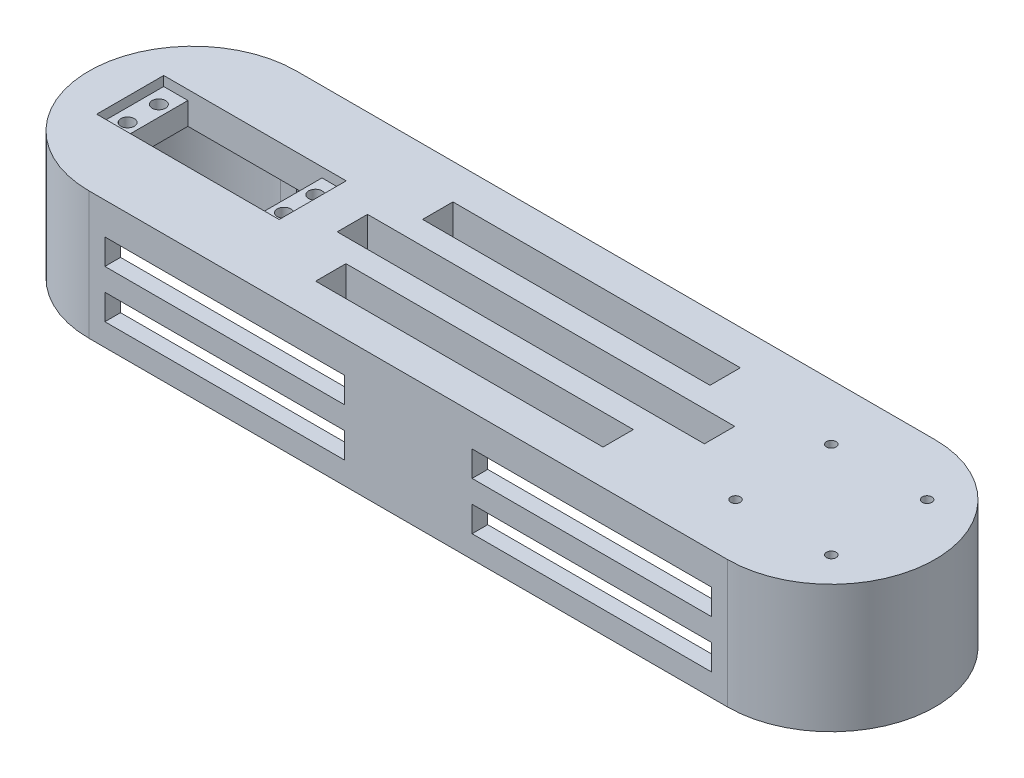
from build123d import *

# Parameters (mm, degrees)
SKETCH1_R           = 2.1
SKETCH1_R_2         = 1.5
SKETCH1_W           = 42
SKETCH1_H           = 21
BOSS_EXTRUDE1_DEPTH = 10
BOSS_EXTRUDE2_START = -30
BOSS_EXTRUDE2_DEPTH = 30
SKETCH3_W           = 75
SKETCH3_H           = 8
CUT_EXTRUDE1_DEPTH  = 45
SKETCH4_W           = 7.58
SKETCH4_H           = 21
CUT_EXTRUDE2_DEPTH  = 3


with BuildPart() as part:
    # Sketch1 → Boss-Extrude1 (new body)
    with BuildSketch(Plane(origin=(0, 0, 0), x_dir=(1, 0, 0), z_dir=(0, 1, 0))):
        with BuildLine():
            Line((-100, 32.5), (100, 32.5))
            ThreePointArc((100, 32.5), (132.5, 0), (100, -32.5))
            Line((100, -32.5), (-100, -32.5))
            ThreePointArc((-100, -32.5), (-132.5, 0), (-100, 32.5))
        make_face()
        with Locations((-115.5, 4.9)):
            Circle(SKETCH1_R, mode=Mode.SUBTRACT)
        with Locations((-115.5, -4.9)):
            Circle(SKETCH1_R, mode=Mode.SUBTRACT)
        with Locations((-66.5, -4.9)):
            Circle(SKETCH1_R, mode=Mode.SUBTRACT)
        with Locations((-66.5, 4.9)):
            Circle(SKETCH1_R, mode=Mode.SUBTRACT)
        with Locations((85, 15)):
            Circle(SKETCH1_R_2, mode=Mode.SUBTRACT)
        with Locations((115, 15)):
            Circle(SKETCH1_R_2, mode=Mode.SUBTRACT)
        with Locations((85, -15)):
            Circle(SKETCH1_R_2, mode=Mode.SUBTRACT)
        with Locations((115, -15)):
            Circle(SKETCH1_R_2, mode=Mode.SUBTRACT)
        with Locations((-91, 0)):
            Rectangle(SKETCH1_W, SKETCH1_H, mode=Mode.SUBTRACT)
        Polygon((0, 21.5), (-40, 21.5), (-40, 12), (0, 12), (50, 12), (50, 21.5), align=None, mode=Mode.SUBTRACT)
        Polygon((-50, 4.75), (0, 4.75), (65, 4.75), (65, -4.75), (0, -4.75), (-50, -4.75), align=None, mode=Mode.SUBTRACT)
        Polygon((0, -12), (-40, -12), (-40, -21.5), (0, -21.5), (50, -21.5), (50, -12), align=None, mode=Mode.SUBTRACT)
    extrude(amount=BOSS_EXTRUDE1_DEPTH)

    # Sketch2 → Boss-Extrude2 (add)
    with BuildSketch(Plane(origin=(0, 0, 0), x_dir=(1, 0, 0), z_dir=(0, 1, 0)).offset(BOSS_EXTRUDE2_START)):
        with BuildLine():
            Line((-100, 32.5), (100, 32.5))
            ThreePointArc((100, 32.5), (132.5, 0), (100, -32.5))
            Line((100, -32.5), (-100, -32.5))
            ThreePointArc((-100, -32.5), (-132.5, 0), (-100, 32.5))
        make_face()
        with BuildLine():
            Line((99.668543355, 27.510998447), (-100, 27.510998447))
            ThreePointArc((-100, 27.510998447), (-127.55585262, -0.044854173), (-100, -27.600706793))
            Line((-100, -27.600706793), (100.998461852, -27.600706793))
            ThreePointArc((100.998461852, -27.600706793), (128.562336478, 0.636345006), (99.668543355, 27.510998447))
        make_face(mode=Mode.SUBTRACT)
    extrude(amount=BOSS_EXTRUDE2_DEPTH)

    # Sketch3 → Cut-Extrude1 (cut, symmetric)
    with BuildSketch(Plane.XY):
        with Locations((-57.5, -19)):
            Rectangle(SKETCH3_W, SKETCH3_H)
        with Locations((57.5, -19)):
            Rectangle(SKETCH3_W, SKETCH3_H)
        with Locations((57.5, -4)):
            Rectangle(SKETCH3_W, SKETCH3_H)
        with Locations((-57.5, -4)):
            Rectangle(SKETCH3_W, SKETCH3_H)
    extrude(amount=CUT_EXTRUDE1_DEPTH, both=True, mode=Mode.SUBTRACT)

    # Sketch4 → Cut-Extrude2 (cut)
    with BuildSketch(Plane(origin=(0, 10, 0), x_dir=(1, 0, 0), z_dir=(0, 1, 0))):
        with Locations((-115.79, 0)):
            Rectangle(SKETCH4_W, SKETCH4_H)
        with Locations((-66.21, 0)):
            Rectangle(SKETCH4_W, SKETCH4_H)
    extrude(amount=-CUT_EXTRUDE2_DEPTH, mode=Mode.SUBTRACT)


solid = part.part
